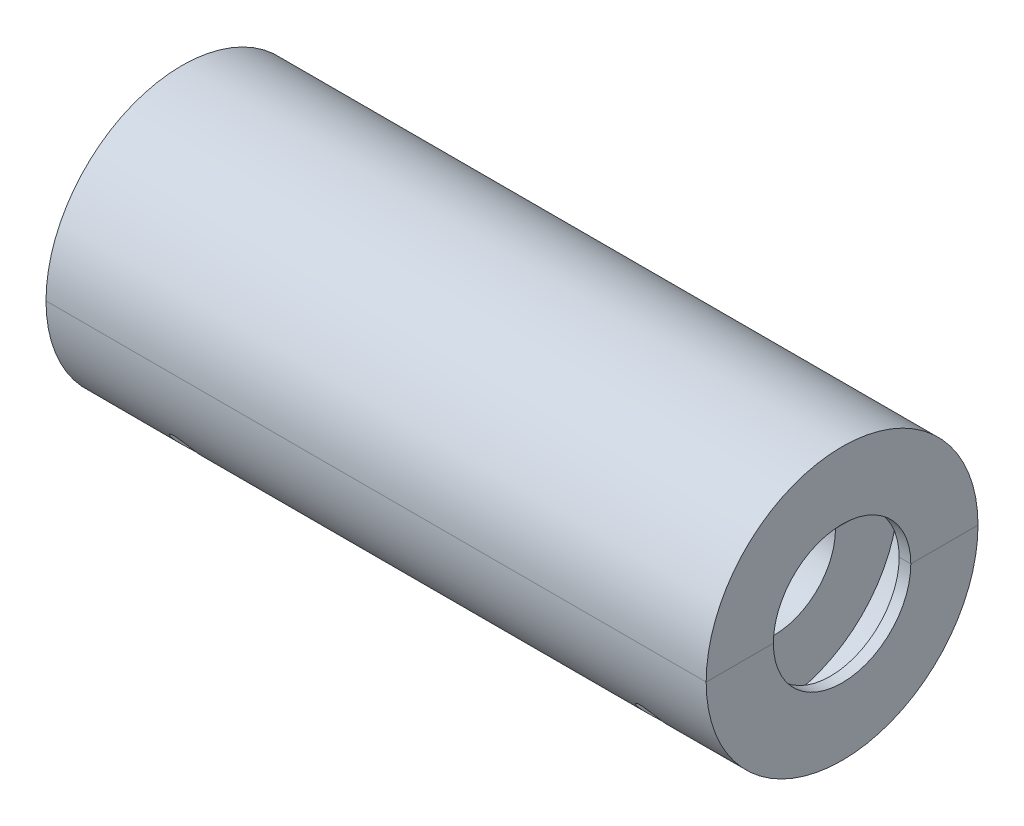
from build123d import *

# Parameters (mm, degrees)
SKETCH1_R                = 35
BOSS_EXTRUDE1_DEPTH      = 85
SHELL1_T                 = -3
SHELL2_T                 = -3
CUT_EXTRUDE1_DEPTH       = 178.059312096
CUT_EXTRUDE1_DEPTH_BACK  = 5
SKETCH2_R                = 20.7
SKETCH3_R                = 17.7
CUT_EXTRUDE2_DEPTH       = 5
BOSS_EXTRUDE2_REACH      = 100.362
BOSS_EXTRUDE2_END_RADIUS = 32
BOSS_EXTRUDE3_REACH      = 102.012
BOSS_EXTRUDE3_START      = 1.65
SKETCH5_W                = 6.2
SKETCH5_H                = 6.2
BOSS_EXTRUDE4_REACH      = 100.362
SKETCH6_W                = 11
SKETCH6_H                = 64
SKETCH7_R                = 18.823686506
CUT_EXTRUDE3_DEPTH       = 11
BOSS_EXTRUDE5_REACH      = 100.362
SKETCH8_W                = 11
SKETCH8_H                = 64
SKETCH9_R                = 15.8
CUT_EXTRUDE4_DEPTH       = 11
SKETCH10_R               = 1.5
CUT_EXTRUDE5_DEPTH       = 7
SKETCH11_R               = 3
CUT_EXTRUDE6_DEPTH       = 99.361577865
SKETCH12_R               = 3
SKETCH12_R_2             = 1.5
BOSS_EXTRUDE6_DEPTH      = 3
SKETCH13_R               = 0.75
CUT_EXTRUDE7_DEPTH       = 3.5
BOSS_EXTRUDE7_REACH      = 117.542
BOSS_EXTRUDE7_END_RADIUS = 35
SKETCH14_W               = 20
SKETCH14_H               = 18
CUT_EXTRUDE8_REACH       = 117.542
CUT_EXTRUDE8_END_RADIUS  = 32
SKETCH15_R               = 6.500094215


with BuildPart() as part:
    # Sketch1 → Boss-Extrude1 (new, symmetric)
    with BuildSketch(Plane(origin=(0, 0, 0), x_dir=(0, 0, -1), z_dir=(1, 0, 0))):
        Circle(SKETCH1_R)
    extrude(amount=BOSS_EXTRUDE1_DEPTH, both=True)


with BuildPart() as body_2:
    # Split1: the piece on the far side of the plane
    add(part.part)
    split(bisect_by=Plane.ZX, keep=Keep.BOTTOM)

    # Shell1
    shell1_openings = [body_2.faces().sort_by_distance(p)[0] for p in [
        (0, 0, 0),
    ]]
    offset(amount=SHELL1_T, openings=shell1_openings)


with BuildPart() as part_1:
    add(part.part)

    # Split1
    split(bisect_by=Plane.ZX, keep=Keep.TOP)

    # Shell2
    shell2_openings = [part_1.faces().sort_by_distance(p)[0] for p in [
        (0, 0, 0),
    ]]
    offset(amount=SHELL2_T, openings=shell2_openings)


with BuildPart() as cut_extrude1_tool:
    # Sketch2 → Cut-Extrude1 (new, two sides: drawn at the far end of the back side and taken through both)
    with BuildSketch(Plane.ZY.offset(85).offset(-CUT_EXTRUDE1_DEPTH_BACK)):
        Circle(SKETCH2_R)
    extrude(amount=CUT_EXTRUDE1_DEPTH + CUT_EXTRUDE1_DEPTH_BACK)


with BuildPart() as part_2:
    add(part_1.part)

    # Cut-Extrude1: cut by cut_extrude1_tool
    add(cut_extrude1_tool.part, mode=Mode.SUBTRACT)


with BuildPart() as body_2_1:
    add(body_2.part)

    # Cut-Extrude1: cut by cut_extrude1_tool
    add(cut_extrude1_tool.part, mode=Mode.SUBTRACT)


with BuildPart() as cut_extrude2_tool:
    # Sketch3 → Cut-Extrude2 (new body)
    with BuildSketch(Plane(origin=(85, 0, 0), x_dir=(0, 0, -1), z_dir=(1, 0, 0))):
        Circle(SKETCH3_R)
    extrude(amount=-CUT_EXTRUDE2_DEPTH)


with BuildPart() as part_3:
    add(part_2.part)

    # Cut-Extrude2: cut by cut_extrude2_tool
    add(cut_extrude2_tool.part, mode=Mode.SUBTRACT)

    # Boss-Extrude2: up to this cylinder (the profile starts inside it)
    boss_extrude2_end = Plane(origin=(4, 0, 0), z_dir=(-1, 0, 0)) * Cylinder(BOSS_EXTRUDE2_END_RADIUS, 317.924, mode=Mode.PRIVATE)
    # Sketch4 → Boss-Extrude2 (add, up to the surface)
    with BuildSketch(Plane(origin=(0, 0, 0), x_dir=(1, 0, 0), z_dir=(0, 1, 0)), mode=Mode.PRIVATE) as boss_extrude2_sk1:
        Polygon((-21.2, -24), (-23, -24), (-23, -32), (-15, -32), (-15, -30.2), (-21.2, -30.2), align=None)
    boss_extrude2_tool1 = extrude(boss_extrude2_sk1.sketch, amount=BOSS_EXTRUDE2_REACH, mode=Mode.PRIVATE) & boss_extrude2_end
    add(boss_extrude2_tool1.solids().sort_by_distance((-22.1, 0, 24.113137))[0])
    # Sketch4 → Boss-Extrude2 (add, up to the surface)
    with BuildSketch(Plane(origin=(0, 0, 0), x_dir=(1, 0, 0), z_dir=(0, 1, 0)), mode=Mode.PRIVATE) as boss_extrude2_sk2:
        Polygon((23, -32), (23, -30.2), (29.2, -30.2), (29.2, -24), (31, -24), (31, -32), align=None)
    boss_extrude2_tool2 = extrude(boss_extrude2_sk2.sketch, amount=BOSS_EXTRUDE2_REACH, mode=Mode.PRIVATE) & boss_extrude2_end
    add(boss_extrude2_tool2.solids().sort_by_distance((23.113137, 0, 31.1))[0])
    # Sketch4 → Boss-Extrude2 (add, up to the surface)
    with BuildSketch(Plane(origin=(0, 0, 0), x_dir=(1, 0, 0), z_dir=(0, 1, 0)), mode=Mode.PRIVATE) as boss_extrude2_sk3:
        Polygon((29.2, 24), (31, 24), (31, 32), (23, 32), (23, 30.2), (29.2, 30.2), align=None)
    boss_extrude2_tool3 = extrude(boss_extrude2_sk3.sketch, amount=BOSS_EXTRUDE2_REACH, mode=Mode.PRIVATE) & boss_extrude2_end
    add(boss_extrude2_tool3.solids().sort_by_distance((30.1, 0, -24.113137))[0])
    # Sketch4 → Boss-Extrude2 (add, up to the surface)
    with BuildSketch(Plane(origin=(0, 0, 0), x_dir=(1, 0, 0), z_dir=(0, 1, 0)), mode=Mode.PRIVATE) as boss_extrude2_sk4:
        Polygon((-15, 32), (-15, 30.2), (-21.2, 30.2), (-21.2, 24), (-23, 24), (-23, 32), align=None)
    boss_extrude2_tool4 = extrude(boss_extrude2_sk4.sketch, amount=BOSS_EXTRUDE2_REACH, mode=Mode.PRIVATE) & boss_extrude2_end
    add(boss_extrude2_tool4.solids().sort_by_distance((-15.113137, 0, -31.1))[0])

    # Sketch5 → Boss-Extrude3 (add, up to next)
    with BuildSketch(Plane(origin=(0, 0, 0), x_dir=(1, 0, 0), z_dir=(0, 1, 0)).offset(BOSS_EXTRUDE3_START), mode=Mode.PRIVATE) as boss_extrude3_sk1:
        with Locations((-18.1, -27.1)):
            Rectangle(SKETCH5_W, SKETCH5_H)
    boss_extrude3_tool1 = extrude(boss_extrude3_sk1.sketch, amount=BOSS_EXTRUDE3_REACH, mode=Mode.PRIVATE) - part_3.part
    # Sketch5 → Boss-Extrude3 (add, up to next)
    with BuildSketch(Plane(origin=(0, 0, 0), x_dir=(1, 0, 0), z_dir=(0, 1, 0)).offset(BOSS_EXTRUDE3_START), mode=Mode.PRIVATE) as boss_extrude3_sk2:
        with Locations((26.1, -27.1)):
            Rectangle(SKETCH5_W, SKETCH5_H)
    boss_extrude3_tool2 = extrude(boss_extrude3_sk2.sketch, amount=BOSS_EXTRUDE3_REACH, mode=Mode.PRIVATE) - part_3.part
    # Sketch5 → Boss-Extrude3 (add, up to next)
    with BuildSketch(Plane(origin=(0, 0, 0), x_dir=(1, 0, 0), z_dir=(0, 1, 0)).offset(BOSS_EXTRUDE3_START), mode=Mode.PRIVATE) as boss_extrude3_sk3:
        with Locations((26.1, 27.1)):
            Rectangle(SKETCH5_W, SKETCH5_H)
    boss_extrude3_tool3 = extrude(boss_extrude3_sk3.sketch, amount=BOSS_EXTRUDE3_REACH, mode=Mode.PRIVATE) - part_3.part
    # Sketch5 → Boss-Extrude3 (add, up to next)
    with BuildSketch(Plane(origin=(0, 0, 0), x_dir=(1, 0, 0), z_dir=(0, 1, 0)).offset(BOSS_EXTRUDE3_START), mode=Mode.PRIVATE) as boss_extrude3_sk4:
        with Locations((-18.1, 27.1)):
            Rectangle(SKETCH5_W, SKETCH5_H)
    boss_extrude3_tool4 = extrude(boss_extrude3_sk4.sketch, amount=BOSS_EXTRUDE3_REACH, mode=Mode.PRIVATE) - part_3.part
    add(boss_extrude3_tool1.solids().sort_by_distance((-18.1, 1.65, 27.1))[0])
    add(boss_extrude3_tool2.solids().sort_by_distance((26.1, 1.65, 27.1))[0])
    add(boss_extrude3_tool3.solids().sort_by_distance((26.1, 1.65, -27.1))[0])
    add(boss_extrude3_tool4.solids().sort_by_distance((-18.1, 1.65, -27.1))[0])


with BuildPart() as body_2_2:
    add(body_2_1.part)

    # Cut-Extrude2: cut by cut_extrude2_tool
    add(cut_extrude2_tool.part, mode=Mode.SUBTRACT)


with BuildPart() as body_3:

    # Sketch6 → Boss-Extrude4 (new, up to next)
    with BuildSketch(Plane(origin=(0, 0, 0), x_dir=(1, 0, 0), z_dir=(0, 1, 0)), mode=Mode.PRIVATE) as boss_extrude4_sk1:
        with Locations((-58, 0)):
            Rectangle(SKETCH6_W, SKETCH6_H)
    boss_extrude4_tool1 = extrude(boss_extrude4_sk1.sketch, amount=BOSS_EXTRUDE4_REACH, mode=Mode.PRIVATE) - part_3.part
    add(boss_extrude4_tool1.solids().sort_by_distance((-58, 0, 0))[0])

    # Sketch7 → Cut-Extrude3 (cut)
    with BuildSketch(Plane.ZY.offset(63.5)):
        Circle(SKETCH7_R)
    extrude(amount=-CUT_EXTRUDE3_DEPTH, mode=Mode.SUBTRACT)


with BuildPart() as body_4:

    # Sketch8 → Boss-Extrude5 (new, up to next)
    with BuildSketch(Plane(origin=(0, 0, 0), x_dir=(1, 0, 0), z_dir=(0, 1, 0)), mode=Mode.PRIVATE) as boss_extrude5_sk1:
        with Locations((62, 0)):
            Rectangle(SKETCH8_W, SKETCH8_H)
    boss_extrude5_tool1 = extrude(boss_extrude5_sk1.sketch, amount=BOSS_EXTRUDE5_REACH, mode=Mode.PRIVATE) - part_3.part
    add(boss_extrude5_tool1.solids().sort_by_distance((62, 0, 0))[0])

    # Sketch9 → Cut-Extrude4 (cut)
    with BuildSketch(Plane(origin=(67.5, 0, 0), x_dir=(0, 0, -1), z_dir=(1, 0, 0))):
        Circle(SKETCH9_R)
    extrude(amount=-CUT_EXTRUDE4_DEPTH, mode=Mode.SUBTRACT)


with BuildPart() as body_5:
    # Mirror2: mirrored copy
    add(body_3.part.mirror(Plane.ZX))


with BuildPart() as body_6:
    # Mirror2 2: mirrored copy
    add(body_4.part.mirror(Plane.ZX))


with BuildPart() as body_2_3:
    add(body_2_2.part)

    # Combine1: read off the stored shape, not the designer's step
    # Combine1: union body 6, body 5
    add(body_6.part)
    add(body_5.part)

    # Sketch11 → Cut-Extrude6 (cut, through all)
    with BuildSketch(Plane.XZ):
        with Locations(Location((-58, -26, 0), (0, 0, 90))):
            Circle(SKETCH11_R)
        with Locations(Location((-58, 26, 0), (0, 0, 90))):
            Circle(SKETCH11_R)
        with Locations(Location((62, -26, 0), (0, 0, 90))):
            Circle(SKETCH11_R)
        with Locations(Location((62, 26, 0), (0, 0, 90))):
            Circle(SKETCH11_R)
    extrude(amount=CUT_EXTRUDE6_DEPTH, mode=Mode.SUBTRACT)

    # Sketch12 → Boss-Extrude6 (add)
    # profile 1 of 4: a face of its own
    with BuildSketch(Plane(origin=(0, 0, 0), x_dir=(1, 0, 0), z_dir=(0, 1, 0))):
        with Locations(Location((-58, -26, 0), (0, 0, 270))):
            Circle(SKETCH12_R)
        with Locations(Location((-58, -26, 0), (0, 0, 90))):
            Circle(SKETCH12_R_2, mode=Mode.SUBTRACT)
    # profile 2 of 4: a face of its own
    with BuildSketch(Plane(origin=(0, 0, 0), x_dir=(1, 0, 0), z_dir=(0, 1, 0))):
        with Locations(Location((62, -26, 0), (0, 0, 270))):
            Circle(SKETCH12_R)
        with Locations(Location((62, -26, 0), (0, 0, 90))):
            Circle(SKETCH12_R_2, mode=Mode.SUBTRACT)
    # profile 3 of 4: a face of its own
    with BuildSketch(Plane(origin=(0, 0, 0), x_dir=(1, 0, 0), z_dir=(0, 1, 0))):
        with Locations(Location((62, 26, 0), (0, 0, 270))):
            Circle(SKETCH12_R)
        with Locations(Location((62, 26, 0), (0, 0, 270))):
            Circle(SKETCH12_R_2, mode=Mode.SUBTRACT)
    # profile 4 of 4: a face of its own
    with BuildSketch(Plane(origin=(0, 0, 0), x_dir=(1, 0, 0), z_dir=(0, 1, 0))):
        with Locations(Location((-58, 26, 0), (0, 0, 270))):
            Circle(SKETCH12_R)
        with Locations(Location((-58, 26, 0), (0, 0, 270))):
            Circle(SKETCH12_R_2, mode=Mode.SUBTRACT)
    extrude(amount=-BOSS_EXTRUDE6_DEPTH)

    # Boss-Extrude7: up to this cylinder (the profile starts outside it)
    boss_extrude7_end = Plane(origin=(0, 0, 0), z_dir=(-1, 0, 0)) * Cylinder(BOSS_EXTRUDE7_END_RADIUS, 306.084, mode=Mode.PRIVATE)
    # Sketch14 → Boss-Extrude7 (add, up to the surface)
    with BuildSketch(Plane.XY.offset(-35), mode=Mode.PRIVATE) as boss_extrude7_sk1:
        with Locations((0, -9)):
            Rectangle(SKETCH14_W, SKETCH14_H)
    boss_extrude7_tool1 = extrude(boss_extrude7_sk1.sketch, amount=BOSS_EXTRUDE7_REACH, mode=Mode.PRIVATE) - boss_extrude7_end
    add(boss_extrude7_tool1.solids().sort_by_distance((0, -9, -35))[0])

    # Cut-Extrude8: up to this cylinder (the profile starts outside it)
    cut_extrude8_end = Plane(origin=(0, 0, 0), z_dir=(-1, 0, 0)) * Cylinder(CUT_EXTRUDE8_END_RADIUS, 300.084, mode=Mode.PRIVATE)
    # Sketch15 → Cut-Extrude8 (cut, up to the surface)
    with BuildSketch(Plane(origin=(0, 0, -35), x_dir=(-1, 0, 0), z_dir=(0, 0, -1)), mode=Mode.PRIVATE) as cut_extrude8_sk1:
        with Locations((0, -8.5)):
            Circle(SKETCH15_R)
    cut_extrude8_tool1 = extrude(cut_extrude8_sk1.sketch, amount=-CUT_EXTRUDE8_REACH, mode=Mode.PRIVATE) - cut_extrude8_end
    add(cut_extrude8_tool1.solids().sort_by_distance((0, -8.5, -35))[0], mode=Mode.SUBTRACT)


with BuildPart() as body_4_1:
    add(body_4.part)

    # Combine2: union body 3, part
    add(body_3.part)
    add(part_3.part)

    # Sketch10 → Cut-Extrude5 (cut)
    with BuildSketch(Plane.XZ):
        with Locations(Location((-58, 26, 0), (0, 0, 270))):
            Circle(SKETCH10_R)
        with Locations(Location((-58, -26, 0), (0, 0, 90))):
            Circle(SKETCH10_R)
        with Locations(Location((62, -26, 0), (0, 0, 90))):
            Circle(SKETCH10_R)
        with Locations(Location((62, 26, 0), (0, 0, 270))):
            Circle(SKETCH10_R)
    extrude(amount=-CUT_EXTRUDE5_DEPTH, mode=Mode.SUBTRACT)

    # Sketch13 → Cut-Extrude7 (cut)
    with BuildSketch(Plane.XZ.offset(-1.65)):
        with Locations(Location((-18.1, 27.1, 0), (0, 0, 270))):
            Circle(SKETCH13_R)
        with Locations(Location((26.1, 27.1, 0), (0, 0, 270))):
            Circle(SKETCH13_R)
        with Locations(Location((26.1, -27.1, 0), (0, 0, 270))):
            Circle(SKETCH13_R)
        with Locations(Location((-18.1, -27.1, 0), (0, 0, 270))):
            Circle(SKETCH13_R)
    extrude(amount=-CUT_EXTRUDE7_DEPTH, mode=Mode.SUBTRACT)


solid = Compound([body_2_3.part, body_4_1.part])
